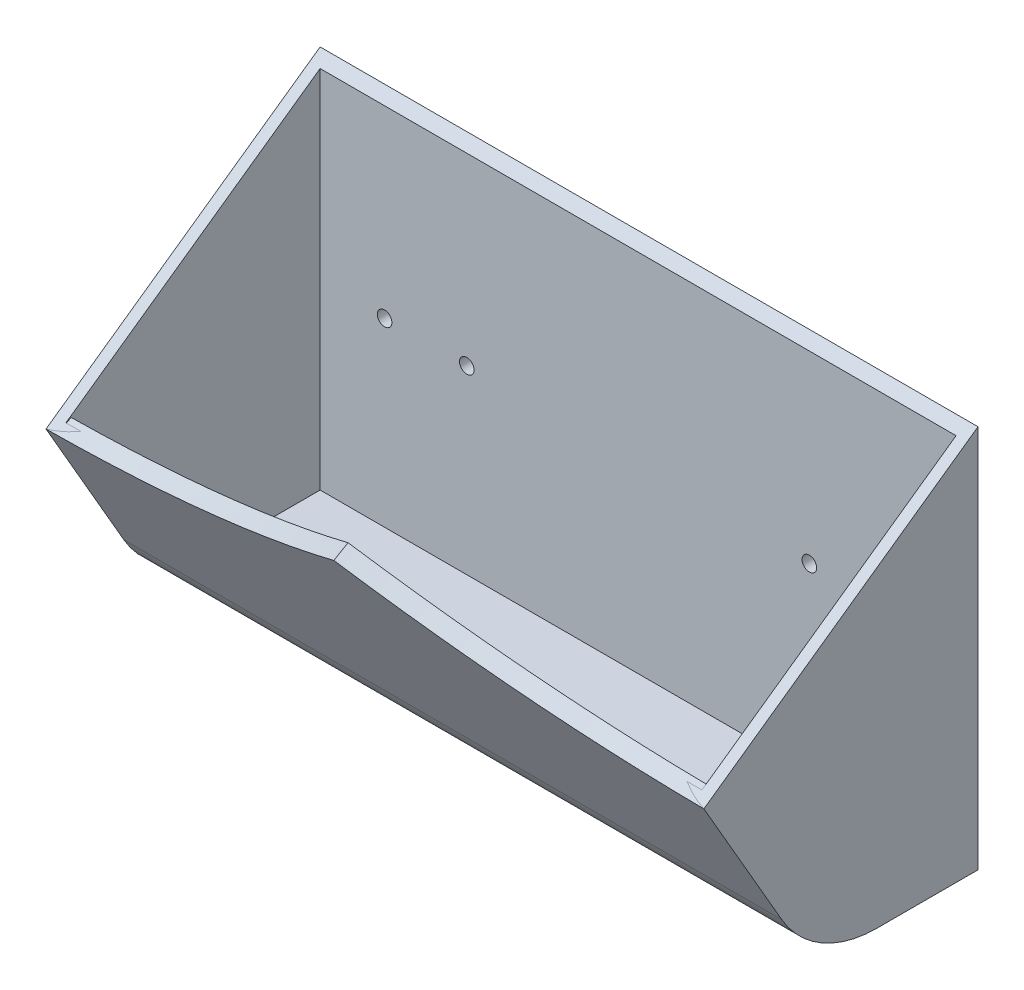
from build123d import *

# Parameters (mm, degrees)
BOSS_EXTRUDE1_DEPTH = 76.2
FILLET1_R           = 25.4
SHELL1_T            = -2.54
BOSS_EXTRUDE4_DEPTH = 3.81
CUT_EXTRUDE2_REACH  = 119.131
SKETCH6_R           = 1.6891


with BuildPart() as part:
    # Sketch2 → Boss-Extrude1 (new, symmetric)
    with BuildSketch(Plane(origin=(0, 0, 0), x_dir=(0, 0, -1), z_dir=(1, 0, 0))):
        Polygon((0, 50.8), (0, -38.1), (-38.1, -38.1), (-63.5, 5.894090512), align=None)
    extrude(amount=BOSS_EXTRUDE1_DEPTH, both=True)

    # Fillet1
    fillet1_edges = [part.edges().sort_by_distance(p)[0] for p in [
        (0, -38.1, 38.1),
    ]]
    fillet(fillet1_edges, radius=FILLET1_R)

    # Shell1
    shell1_openings = [part.faces().sort_by_distance(p)[0] for p in [
        (0, 28.347045256, 31.75),
    ]]
    offset(amount=SHELL1_T, openings=shell1_openings, kind=Kind.INTERSECTION)

    # Sketch3 → Boss-Extrude4 (add)
    with BuildSketch(Plane(origin=(0, -26.022783942, 45.072783942), x_dir=(1, 0, 0), z_dir=(0, -0.4999999999999981, 0.8660254037844398))):
        with BuildLine():
            Line((-76.2, 36.854432116), (76.2, 36.854432116))
            ThreePointArc((76.2, 36.854432116), (37.034902357, 42.119041544), (0, 55.904432116))
            ThreePointArc((0, 55.904432116), (-37.034902357, 42.119041544), (-76.2, 36.854432116))
        make_face()
    extrude(amount=-BOSS_EXTRUDE4_DEPTH)

    # Sketch6 → Cut-Extrude2 (cut, up to next)
    with BuildSketch(Plane(origin=(0, 0, 0), x_dir=(-1, 0, 0), z_dir=(0, 0, -1)), mode=Mode.PRIVATE) as cut_extrude2_sk1:
        with Locations((-58.7248, 6.35)):
            Circle(SKETCH6_R)
    cut_extrude2_tool1 = extrude(cut_extrude2_sk1.sketch, amount=-CUT_EXTRUDE2_REACH, mode=Mode.PRIVATE) & part.part
    # Sketch6 → Cut-Extrude2 (cut, up to next)
    with BuildSketch(Plane(origin=(0, 0, 0), x_dir=(-1, 0, 0), z_dir=(0, 0, -1)), mode=Mode.PRIVATE) as cut_extrude2_sk2:
        with Locations((-39.6748, 6.35)):
            Circle(SKETCH6_R)
    cut_extrude2_tool2 = extrude(cut_extrude2_sk2.sketch, amount=-CUT_EXTRUDE2_REACH, mode=Mode.PRIVATE) & part.part
    # Sketch6 → Cut-Extrude2 (cut, up to next)
    with BuildSketch(Plane(origin=(0, 0, 0), x_dir=(-1, 0, 0), z_dir=(0, 0, -1)), mode=Mode.PRIVATE) as cut_extrude2_sk3:
        with Locations((39.6748, 6.35)):
            Circle(SKETCH6_R)
    cut_extrude2_tool3 = extrude(cut_extrude2_sk3.sketch, amount=-CUT_EXTRUDE2_REACH, mode=Mode.PRIVATE) & part.part
    # Sketch6 → Cut-Extrude2 (cut, up to next)
    with BuildSketch(Plane(origin=(0, 0, 0), x_dir=(-1, 0, 0), z_dir=(0, 0, -1)), mode=Mode.PRIVATE) as cut_extrude2_sk4:
        with Locations((58.7248, 6.35)):
            Circle(SKETCH6_R)
    cut_extrude2_tool4 = extrude(cut_extrude2_sk4.sketch, amount=-CUT_EXTRUDE2_REACH, mode=Mode.PRIVATE) & part.part
    add(cut_extrude2_tool1.solids().sort_by_distance((58.7248, 6.35, 0))[0], mode=Mode.SUBTRACT)
    add(cut_extrude2_tool2.solids().sort_by_distance((39.6748, 6.35, 0))[0], mode=Mode.SUBTRACT)
    add(cut_extrude2_tool3.solids().sort_by_distance((-39.6748, 6.35, 0))[0], mode=Mode.SUBTRACT)
    add(cut_extrude2_tool4.solids().sort_by_distance((-58.7248, 6.35, 0))[0], mode=Mode.SUBTRACT)


solid = part.part
